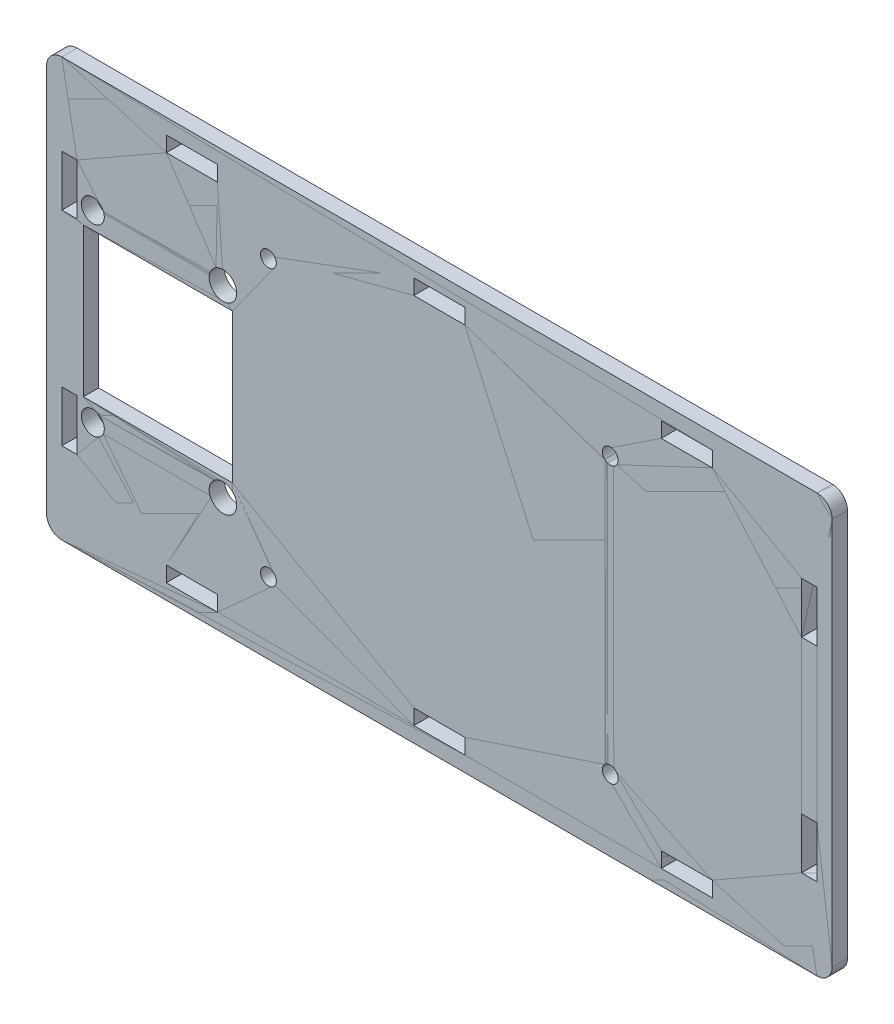
from build123d import *

# Parameters (mm, degrees)
SKETCH_1_3_R    = 1.55
SKETCH_1_3_R_2  = 2.7
SKETCH_1_3_R_3  = 2.248701309
SKETCH_1_3_W    = 3
SKETCH_1_3_H    = 10
SKETCH_1_3_W_2  = 10
SKETCH_1_3_H_2  = 3
SKETCH_1_3_W_3  = 29.22
SKETCH_1_3_H_3  = 29.16
EXTRUDE_3_DEPTH = 3
SKETCH_1_2_R    = 1.55
SKETCH_1_2_R_2  = 2.7
SKETCH_1_2_R_3  = 2.248701309
SKETCH_1_2_W    = 3
SKETCH_1_2_H    = 10
SKETCH_1_2_W_2  = 10
SKETCH_1_2_H_2  = 3
SKETCH_1_2_W_3  = 29.22
SKETCH_1_2_H_3  = 29.16
EXTRUDE_2_DEPTH = 3
SKETCH_1_R      = 1.55
SKETCH_1_R_2    = 2.7
SKETCH_1_R_3    = 2.248701309
SKETCH_1_W      = 3
SKETCH_1_H      = 10
SKETCH_1_W_2    = 10
SKETCH_1_H_2    = 3
SKETCH_1_W_3    = 29.22
SKETCH_1_H_3    = 29.16
EXTRUDE_1_DEPTH = 3


with BuildPart() as part:
    # 草图1<3> → 凸台-拉伸3 (new body)
    with BuildSketch(Plane.XY):
        with BuildLine():
            Line((-74, 31.498753117), (74, 31.498753117))
            ThreePointArc((74, 31.498753117), (76.121320344, 30.620073461), (77, 28.498753117))
            Line((77, 28.498753117), (77, -47.501246883))
            ThreePointArc((77, -47.501246883), (76.121320344, -49.622567226), (74, -50.501246883))
            Line((74, -50.501246883), (-74, -50.501246883))
            ThreePointArc((-74, -50.501246883), (-76.121320344, -49.622567226), (-77, -47.501246883))
            Line((-77, -47.501246883), (-77, 28.498753117))
            ThreePointArc((-77, 28.498753117), (-76.121320344, 30.620073461), (-74, 31.498753117))
        make_face()
        with Locations((-33.5, 17.5)):
            Circle(SKETCH_1_3_R, mode=Mode.SUBTRACT)
        with Locations((-33.5, -36.502493766)):
            Circle(SKETCH_1_3_R, mode=Mode.SUBTRACT)
        with Locations((33.5, -36.502493766)):
            Circle(SKETCH_1_3_R, mode=Mode.SUBTRACT)
        with Locations((33.5, 17.5)):
            Circle(SKETCH_1_3_R, mode=Mode.SUBTRACT)
        with Locations((-42.419949528, 8.498753117)):
            Circle(SKETCH_1_3_R_2, mode=Mode.SUBTRACT)
        with Locations((-67.919949528, 8.498753117)):
            Circle(SKETCH_1_3_R_3, mode=Mode.SUBTRACT)
        with Locations((-67.919949528, -27.501246883)):
            Circle(SKETCH_1_3_R_3, mode=Mode.SUBTRACT)
        with Locations((-42.419949528, -27.501246883)):
            Circle(SKETCH_1_3_R_2, mode=Mode.SUBTRACT)
        with Locations((-72.5, -29.501246883)):
            Rectangle(SKETCH_1_3_W, SKETCH_1_3_H, mode=Mode.SUBTRACT)
        with Locations((-48.5, -46.001246883)):
            Rectangle(SKETCH_1_3_W_2, SKETCH_1_3_H_2, mode=Mode.SUBTRACT)
        with Locations((0, -46.001246883)):
            Rectangle(SKETCH_1_3_W_2, SKETCH_1_3_H_2, mode=Mode.SUBTRACT)
        with Locations((0, 26.998753117)):
            Rectangle(SKETCH_1_3_W_2, SKETCH_1_3_H_2, mode=Mode.SUBTRACT)
        with Locations((-48.5, 26.998753117)):
            Rectangle(SKETCH_1_3_W_2, SKETCH_1_3_H_2, mode=Mode.SUBTRACT)
        with Locations((-72.5, 10.498753117)):
            Rectangle(SKETCH_1_3_W, SKETCH_1_3_H, mode=Mode.SUBTRACT)
        with Locations((48.5, -46.001246883)):
            Rectangle(SKETCH_1_3_W_2, SKETCH_1_3_H_2, mode=Mode.SUBTRACT)
        with Locations((72.5, -29.501246883)):
            Rectangle(SKETCH_1_3_W, SKETCH_1_3_H, mode=Mode.SUBTRACT)
        with Locations((72.5, 10.498753117)):
            Rectangle(SKETCH_1_3_W, SKETCH_1_3_H, mode=Mode.SUBTRACT)
        with Locations((48.5, 26.998753117)):
            Rectangle(SKETCH_1_3_W_2, SKETCH_1_3_H_2, mode=Mode.SUBTRACT)
        with Locations((-55.169949528, -9.501246883)):
            Rectangle(SKETCH_1_3_W_3, SKETCH_1_3_H_3, mode=Mode.SUBTRACT)
    extrude(amount=EXTRUDE_3_DEPTH)


with BuildPart() as body_2:
    # 草图1<2> → 凸台-拉伸2 (new body)
    with BuildSketch(Plane.XY):
        with BuildLine():
            Line((-74, 31.498753117), (74, 31.498753117))
            ThreePointArc((74, 31.498753117), (76.121320344, 30.620073461), (77, 28.498753117))
            Line((77, 28.498753117), (77, -47.501246883))
            ThreePointArc((77, -47.501246883), (76.121320344, -49.622567226), (74, -50.501246883))
            Line((74, -50.501246883), (-74, -50.501246883))
            ThreePointArc((-74, -50.501246883), (-76.121320344, -49.622567226), (-77, -47.501246883))
            Line((-77, -47.501246883), (-77, 28.498753117))
            ThreePointArc((-77, 28.498753117), (-76.121320344, 30.620073461), (-74, 31.498753117))
        make_face()
        with Locations((-33.5, 17.5)):
            Circle(SKETCH_1_2_R, mode=Mode.SUBTRACT)
        with Locations((-33.5, -36.502493766)):
            Circle(SKETCH_1_2_R, mode=Mode.SUBTRACT)
        with Locations((33.5, -36.502493766)):
            Circle(SKETCH_1_2_R, mode=Mode.SUBTRACT)
        with Locations((33.5, 17.5)):
            Circle(SKETCH_1_2_R, mode=Mode.SUBTRACT)
        with Locations((-42.419949528, 8.498753117)):
            Circle(SKETCH_1_2_R_2, mode=Mode.SUBTRACT)
        with Locations((-67.919949528, 8.498753117)):
            Circle(SKETCH_1_2_R_3, mode=Mode.SUBTRACT)
        with Locations((-67.919949528, -27.501246883)):
            Circle(SKETCH_1_2_R_3, mode=Mode.SUBTRACT)
        with Locations((-42.419949528, -27.501246883)):
            Circle(SKETCH_1_2_R_2, mode=Mode.SUBTRACT)
        with Locations((-72.5, -29.501246883)):
            Rectangle(SKETCH_1_2_W, SKETCH_1_2_H, mode=Mode.SUBTRACT)
        with Locations((-48.5, -46.001246883)):
            Rectangle(SKETCH_1_2_W_2, SKETCH_1_2_H_2, mode=Mode.SUBTRACT)
        with Locations((0, -46.001246883)):
            Rectangle(SKETCH_1_2_W_2, SKETCH_1_2_H_2, mode=Mode.SUBTRACT)
        with Locations((0, 26.998753117)):
            Rectangle(SKETCH_1_2_W_2, SKETCH_1_2_H_2, mode=Mode.SUBTRACT)
        with Locations((-48.5, 26.998753117)):
            Rectangle(SKETCH_1_2_W_2, SKETCH_1_2_H_2, mode=Mode.SUBTRACT)
        with Locations((-72.5, 10.498753117)):
            Rectangle(SKETCH_1_2_W, SKETCH_1_2_H, mode=Mode.SUBTRACT)
        with Locations((48.5, -46.001246883)):
            Rectangle(SKETCH_1_2_W_2, SKETCH_1_2_H_2, mode=Mode.SUBTRACT)
        with Locations((72.5, -29.501246883)):
            Rectangle(SKETCH_1_2_W, SKETCH_1_2_H, mode=Mode.SUBTRACT)
        with Locations((72.5, 10.498753117)):
            Rectangle(SKETCH_1_2_W, SKETCH_1_2_H, mode=Mode.SUBTRACT)
        with Locations((48.5, 26.998753117)):
            Rectangle(SKETCH_1_2_W_2, SKETCH_1_2_H_2, mode=Mode.SUBTRACT)
        with Locations((-55.169949528, -9.501246883)):
            Rectangle(SKETCH_1_2_W_3, SKETCH_1_2_H_3, mode=Mode.SUBTRACT)
    extrude(amount=EXTRUDE_2_DEPTH)


with BuildPart() as body_3:
    # 草图1 → 凸台-拉伸1 (new body)
    with BuildSketch(Plane.XY):
        with BuildLine():
            Line((-74, 31.498753117), (74, 31.498753117))
            ThreePointArc((74, 31.498753117), (76.121320344, 30.620073461), (77, 28.498753117))
            Line((77, 28.498753117), (77, -47.501246883))
            ThreePointArc((77, -47.501246883), (76.121320344, -49.622567226), (74, -50.501246883))
            Line((74, -50.501246883), (-74, -50.501246883))
            ThreePointArc((-74, -50.501246883), (-76.121320344, -49.622567226), (-77, -47.501246883))
            Line((-77, -47.501246883), (-77, 28.498753117))
            ThreePointArc((-77, 28.498753117), (-76.121320344, 30.620073461), (-74, 31.498753117))
        make_face()
        with Locations((-33.5, 17.5)):
            Circle(SKETCH_1_R, mode=Mode.SUBTRACT)
        with Locations((-33.5, -36.502493766)):
            Circle(SKETCH_1_R, mode=Mode.SUBTRACT)
        with Locations((33.5, -36.502493766)):
            Circle(SKETCH_1_R, mode=Mode.SUBTRACT)
        with Locations((33.5, 17.5)):
            Circle(SKETCH_1_R, mode=Mode.SUBTRACT)
        with Locations((-42.419949528, 8.498753117)):
            Circle(SKETCH_1_R_2, mode=Mode.SUBTRACT)
        with Locations((-67.919949528, 8.498753117)):
            Circle(SKETCH_1_R_3, mode=Mode.SUBTRACT)
        with Locations((-67.919949528, -27.501246883)):
            Circle(SKETCH_1_R_3, mode=Mode.SUBTRACT)
        with Locations((-42.419949528, -27.501246883)):
            Circle(SKETCH_1_R_2, mode=Mode.SUBTRACT)
        with Locations((-72.5, -29.501246883)):
            Rectangle(SKETCH_1_W, SKETCH_1_H, mode=Mode.SUBTRACT)
        with Locations((-48.5, -46.001246883)):
            Rectangle(SKETCH_1_W_2, SKETCH_1_H_2, mode=Mode.SUBTRACT)
        with Locations((0, -46.001246883)):
            Rectangle(SKETCH_1_W_2, SKETCH_1_H_2, mode=Mode.SUBTRACT)
        with Locations((0, 26.998753117)):
            Rectangle(SKETCH_1_W_2, SKETCH_1_H_2, mode=Mode.SUBTRACT)
        with Locations((-48.5, 26.998753117)):
            Rectangle(SKETCH_1_W_2, SKETCH_1_H_2, mode=Mode.SUBTRACT)
        with Locations((-72.5, 10.498753117)):
            Rectangle(SKETCH_1_W, SKETCH_1_H, mode=Mode.SUBTRACT)
        with Locations((48.5, -46.001246883)):
            Rectangle(SKETCH_1_W_2, SKETCH_1_H_2, mode=Mode.SUBTRACT)
        with Locations((72.5, -29.501246883)):
            Rectangle(SKETCH_1_W, SKETCH_1_H, mode=Mode.SUBTRACT)
        with Locations((72.5, 10.498753117)):
            Rectangle(SKETCH_1_W, SKETCH_1_H, mode=Mode.SUBTRACT)
        with Locations((48.5, 26.998753117)):
            Rectangle(SKETCH_1_W_2, SKETCH_1_H_2, mode=Mode.SUBTRACT)
        with Locations((-55.169949528, -9.501246883)):
            Rectangle(SKETCH_1_W_3, SKETCH_1_H_3, mode=Mode.SUBTRACT)
    extrude(amount=EXTRUDE_1_DEPTH)


solid = Compound([part.part, body_2.part, body_3.part])
